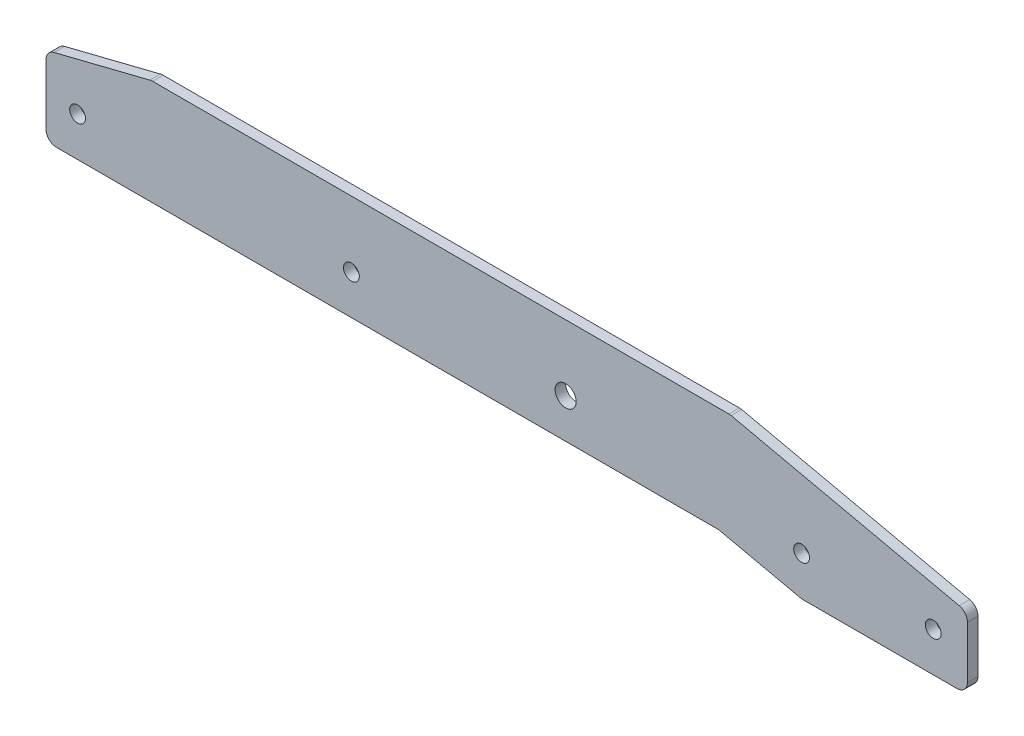
from build123d import *

# Parameters (mm, degrees)
EXTRUDE_1546_DEPTH     = 2
SKETCH_2_R             = 1.5
CUT_EXTRUDE_2511_DEPTH = 193.709547685
SKETCH_3_R             = 1.5
CUT_EXTRUDE_2733_DEPTH = 193.709547685
SKETCH_4_R             = 2
CUT_EXTRUDE_2961_DEPTH = 193.709547685
CHAMFER_4_SIZE         = 20
CHAMFER_4_SIZE2        = 5
FILLET_12_R            = 2


with BuildPart() as part:
    # Sketch 1 → Extrude 1546 (new body)
    with BuildSketch(Plane.XY):
        Polygon((-187.371208485, -21.5), (-187.371208485, -41.5), (-108.833876059, -41.5), (-59.652902202, -41.5), (-43.871208485, -45), (-12.371208485, -45), (-12.371208485, -31.5), (-57.461761963, -21.5), (-110.058240167, -21.5), align=None)
    extrude(amount=EXTRUDE_1546_DEPTH)

    # Эскиз2 → Cut-Extrude 2511 (cut, through all)
    with BuildSketch(Plane.XY.offset(2)):
        with Locations((-181.371208485, -34)):
            Circle(SKETCH_2_R)
        with Locations((-129.371208485, -34)):
            Circle(SKETCH_2_R)
    extrude(amount=-CUT_EXTRUDE_2511_DEPTH, mode=Mode.SUBTRACT)

    # Эскиз3 → Cut-Extrude 2733 (cut, through all)
    with BuildSketch(Plane.XY.offset(2)):
        with Locations((-43.871208485, -37.5)):
            Circle(SKETCH_3_R)
        with Locations((-18.871208485, -37.5)):
            Circle(SKETCH_3_R)
    extrude(amount=-CUT_EXTRUDE_2733_DEPTH, mode=Mode.SUBTRACT)

    # Эскиз4 → Cut-Extrude 2961 (cut, through all)
    with BuildSketch(Plane.XY.offset(2)):
        with Locations((-88.686728908, -34)):
            Circle(SKETCH_4_R)
    extrude(amount=-CUT_EXTRUDE_2961_DEPTH, mode=Mode.SUBTRACT)

    # Фаска4
    chamfer_4_edges = [part.edges().sort_by_distance(p)[0] for p in [
        (-187.371208485, -21.5, 1),
    ]]
    chamfer_4_side = [part.faces().sort_by_distance(p)[0] for p in [
        (-122.416485224, -21.5, 1),
    ]]
    chamfer(chamfer_4_edges, length=CHAMFER_4_SIZE, length2=CHAMFER_4_SIZE2, reference=chamfer_4_side[0])

    # Fillet 12
    fillet_12_edges = [part.edges().sort_by_distance(p)[0] for p in [
        (-12.371208485, -45, 1),
        (-187.371208485, -41.5, 1),
        (-43.871208485, -45, 1),
        (-59.652902202, -41.5, 1),
        (-57.461761963, -21.5, 1),
        (-167.371208485, -21.5, 1),
        (-187.371208485, -26.5, 1),
        (-12.371208485, -31.5, 1),
    ]]
    fillet(fillet_12_edges, radius=FILLET_12_R)


solid = part.part
